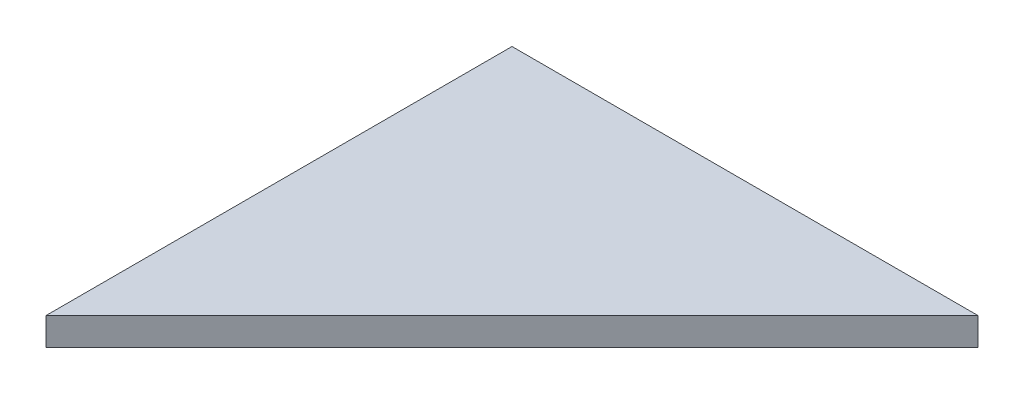
from build123d import *

# Parameters (mm, degrees)
BOSS_EXTRUDE1_DEPTH = 1.5


with BuildPart() as part:
    # Sketch1 → Boss-Extrude1 (new, symmetric)
    with BuildSketch(Plane(origin=(0, -113.704878, 0), x_dir=(-1, 0, 0), z_dir=(0, -1, 0))):
        Polygon((-93.853795945, -43.353795945), (-43.353795945, -93.853795945), (-43.353795945, -43.353795945), align=None)
    extrude(amount=BOSS_EXTRUDE1_DEPTH, both=True)


solid = part.part
